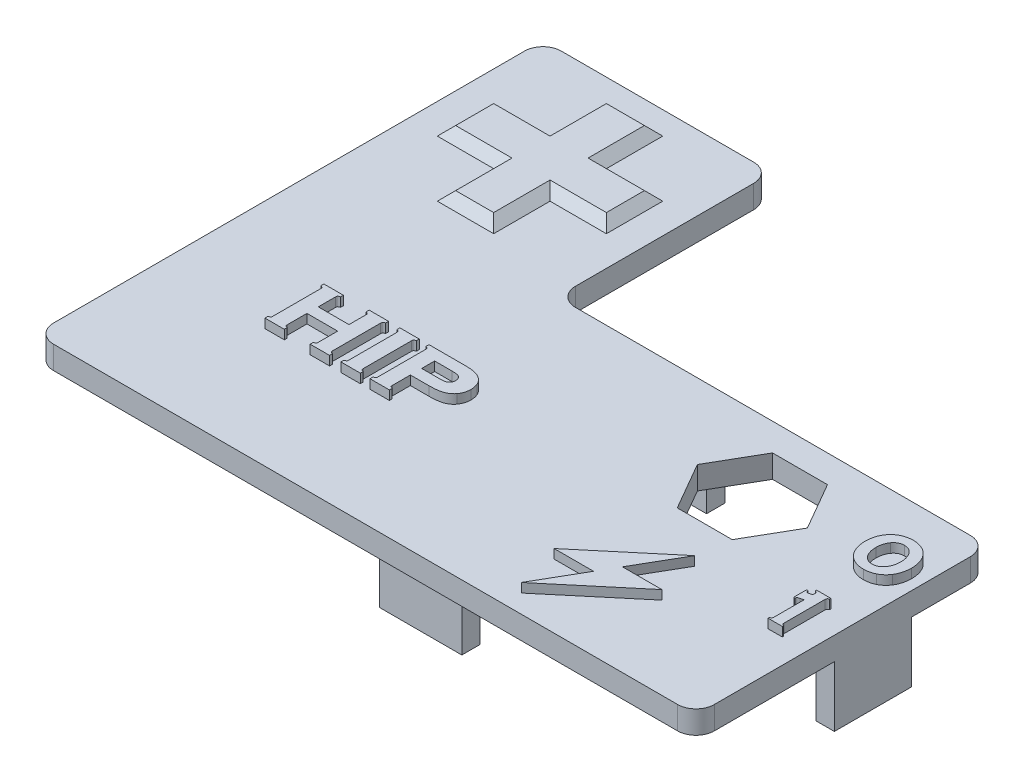
from build123d import *

# Parameters (mm, degrees)
BOSS_EXTRUDE1_DEPTH = 2.5
FILLET1_R           = 2
SKETCH2_W           = 2
SKETCH2_H           = 8.4
SKETCH2_W_2         = 9
SKETCH2_H_2         = 2
BOSS_EXTRUDE2_DEPTH = 6.6
BOSS_EXTRUDE3_DEPTH = 1
CUT_EXTRUDE1_DEPTH  = 2.5
CHAMFER1_SIZE       = 1


with BuildPart() as part:
    # Sketch1 → Boss-Extrude1 (new body)
    with BuildSketch(Plane(origin=(0, 0, 0), x_dir=(1, 0, 0), z_dir=(0, 1, 0))):
        Polygon((-36.05, 15.975), (-36.05, 39.425), (-11.05, 39.425), (-11.05, 15.975), (36.05, 15.975), (36.05, -15.975), (-36.05, -15.975), align=None)
    extrude(amount=BOSS_EXTRUDE1_DEPTH)

    # Fillet1
    fillet1_edges = [part.edges().sort_by_distance(p)[0] for p in [
        (36.05, 1.25, 15.975),
        (-36.05, 1.25, 15.975),
        (-36.05, 1.25, -39.425),
        (-11.05, 1.25, -39.425),
        (-11.05, 1.25, -15.975),
        (36.05, 1.25, -15.975),
    ]]
    fillet(fillet1_edges, radius=FILLET1_R)

    # Sketch2 → Boss-Extrude2 (add)
    with BuildSketch(Plane.XZ):
        with Locations((35.05, -3.325)):
            Rectangle(SKETCH2_W, SKETCH2_H)
        with Locations((4, -13.725)):
            Rectangle(SKETCH2_W_2, SKETCH2_H_2)
        with Locations((4, 12.975)):
            Rectangle(SKETCH2_W_2, SKETCH2_H_2)
    extrude(amount=BOSS_EXTRUDE2_DEPTH)

    # Sketch3 → Boss-Extrude3 (add)
    # profile 1 of 7: a face of its own
    with BuildSketch(Plane(origin=(0, 2.5, 0), x_dir=(1, 0, 0), z_dir=(0, 1, 0))):
        Polygon((21.914101615, -1.975), (19.027350269, -6.975), (23.328173533, -6.975), (14.985898385, -13.975), (17.872649731, -8.975), (13.571826467, -8.975), align=None)
    # profile 2 of 7: a face of its own
    with BuildSketch(Plane(origin=(0, 2.5, 0), x_dir=(1, 0, 0), z_dir=(0, 1, 0))):
        Polygon((-26.625, 36.925), (-20.475, 36.925), (-20.475, 30.775), (-14.325, 30.775), (-14.325, 24.625), (-20.475, 24.625), (-20.475, 18.475), (-26.625, 18.475), (-26.625, 24.625), (-32.775, 24.625), (-32.775, 30.775), (-26.625, 30.775), align=None)
    # profile 3 of 7: a face of its own
    with BuildSketch(Plane(origin=(0, 2.5, 0), x_dir=(1, 0, 0), z_dir=(0, 1, 0))):
        with BuildLine():
            Line((-18.783680556, -0.240972222), (-22.135069444, -0.240972222))
            Line((-22.135069444, -0.240972222), (-22.135069444, -2.383821615))
            add(Edge.make_bspline(
                [(-22.135069444, -2.383821615), (-22.134560924, -2.404062044), (-22.133632782, -2.441004541), (-22.126724134, -2.491370285), (-22.116913761, -2.531950328), (-22.099135807, -2.565289708), (-22.065927707, -2.591094351), (-22.017431016, -2.614286603), (-21.950045692, -2.63858303), (-21.899033709, -2.654599914), (-21.870486111, -2.663563368)],
                knots=[0, 0, 0, 0, 1.112689861, 2.030863194, 2.79083513, 3.401849183, 4.06495506, 5.059212787, 6.354261028, 8, 8, 8, 8], degree=3))
            Line((-21.870486111, -2.663563368), (-21.870486111, -2.975))
            Line((-21.870486111, -2.975), (-23.987152778, -2.975))
            Line((-23.987152778, -2.975), (-23.987152778, -2.645648872))
            add(Edge.make_bspline(
                [(-23.987152778, -2.645648872), (-23.959096859, -2.636151769), (-23.908590644, -2.619055102), (-23.841611165, -2.594288211), (-23.793801903, -2.568428587), (-23.750828013, -2.534493362), (-23.7260889, -2.468688109), (-23.723848947, -2.41467495), (-23.722569444, -2.383821615)],
                knots=[0, 0, 0, 0, 1.287370472, 2.317522002, 3.094744379, 3.646673391, 4.655735433, 6, 6, 6, 6], degree=3))
            Line((-23.722569444, -2.383821615), (-23.722569444, 2.872016059))
            add(Edge.make_bspline(
                [(-23.722569444, 2.872016059), (-23.723733083, 2.90291911), (-23.725754515, 2.956602786), (-23.751219243, 3.02155467), (-23.793784799, 3.055250295), (-23.84161821, 3.081102433), (-23.908588108, 3.105872295), (-23.959095953, 3.122968456), (-23.987152778, 3.132465278)],
                knots=[0, 0, 0, 0, 1.348336138, 2.342281394, 2.895882114, 3.675458579, 4.708730281, 6, 6, 6, 6], degree=3))
            Line((-23.987152778, 3.132465278), (-23.987152778, 3.463194444))
            Line((-23.987152778, 3.463194444), (-21.870486111, 3.463194444))
            Line((-21.870486111, 3.463194444), (-21.870486111, 3.149001736))
            add(Edge.make_bspline(
                [(-21.870486111, 3.149001736), (-21.899576345, 3.140736863), (-21.951329502, 3.12603319), (-22.018368384, 3.100588695), (-22.067489274, 3.079363184), (-22.100250623, 3.053980126), (-22.116641214, 3.021221078), (-22.12702454, 2.98196032), (-22.133489042, 2.932384698), (-22.134513812, 2.895920899), (-22.135069444, 2.876150174)],
                knots=[0, 0, 0, 0, 1.678835892, 2.986743234, 3.979464292, 4.649154438, 5.231503203, 5.974457713, 6.90174799, 8, 8, 8, 8], degree=3))
            Line((-22.135069444, 2.876150174), (-22.135069444, 0.99375))
            Line((-22.135069444, 0.99375), (-18.783680556, 0.99375))
            Line((-18.783680556, 0.99375), (-18.783680556, 2.876150174))
            add(Edge.make_bspline(
                [(-18.783680556, 2.876150174), (-18.784635458, 2.906725209), (-18.786330305, 2.960992525), (-18.8148026, 3.024988409), (-18.857552607, 3.059427337), (-18.904962855, 3.085011392), (-18.970713212, 3.108918029), (-19.020601198, 3.123179378), (-19.048263889, 3.13108724)],
                knots=[0, 0, 0, 0, 1.339108124, 2.3767692, 2.934819577, 3.720662016, 4.736116083, 6, 6, 6, 6], degree=3))
            Line((-19.048263889, 3.13108724), (-19.048263889, 3.463194444))
            Line((-19.048263889, 3.463194444), (-16.931597222, 3.463194444))
            Line((-16.931597222, 3.463194444), (-16.931597222, 3.151757813))
            add(Edge.make_bspline(
                [(-16.931597222, 3.151757813), (-16.96061746, 3.142373337), (-17.01260413, 3.125562048), (-17.080746578, 3.099834777), (-17.129679953, 3.076489432), (-17.162782162, 3.051272443), (-17.179053242, 3.018441172), (-17.189880598, 2.979312497), (-17.194074053, 2.929039758), (-17.195434196, 2.892220265), (-17.196180556, 2.872016059)],
                knots=[0, 0, 0, 0, 1.677063113, 3.004280154, 3.998210204, 4.661097541, 5.237530725, 5.972938197, 6.887676847, 8, 8, 8, 8], degree=3))
            Line((-17.196180556, 2.872016059), (-17.196180556, -2.383821615))
            add(Edge.make_bspline(
                [(-17.196180556, -2.383821615), (-17.195466383, -2.404487304), (-17.194177923, -2.441770881), (-17.189676161, -2.492921509), (-17.179245547, -2.532520488), (-17.163133146, -2.565849021), (-17.129338032, -2.589006053), (-17.082054183, -2.613649766), (-17.013482048, -2.638792842), (-16.961049667, -2.655536255), (-16.931597222, -2.664941406)],
                knots=[0, 0, 0, 0, 1.132588045, 2.043335292, 2.79974177, 3.373659724, 4.017655279, 4.984956659, 6.306382474, 8, 8, 8, 8], degree=3))
            Line((-16.931597222, -2.664941406), (-16.931597222, -2.975))
            Line((-16.931597222, -2.975), (-19.048263889, -2.975))
            Line((-19.048263889, -2.975), (-19.048263889, -2.644270833))
            add(Edge.make_bspline(
                [(-19.048263889, -2.644270833), (-19.020513353, -2.636054777), (-18.970409832, -2.62122071), (-18.90582761, -2.594668492), (-18.856663596, -2.571594882), (-18.8151216, -2.534759181), (-18.786242395, -2.470161631), (-18.784603157, -2.414915461), (-18.783680556, -2.383821615)],
                knots=[0, 0, 0, 0, 1.258257265, 2.271780215, 3.040906906, 3.607086496, 4.653211897, 6, 6, 6, 6], degree=3))
            Line((-18.783680556, -2.383821615), (-18.783680556, -0.240972222))
        make_face()
    # profile 4 of 7: a face of its own
    with BuildSketch(Plane(origin=(0, 2.5, 0), x_dir=(1, 0, 0), z_dir=(0, 1, 0))):
        with BuildLine():
            Line((-15.432291667, -2.378309462), (-15.432291667, 2.872016059))
            add(Edge.make_bspline(
                [(-15.432291667, 2.872016059), (-15.433455305, 2.90291911), (-15.435476737, 2.956602786), (-15.460941465, 3.02155467), (-15.503507021, 3.055250295), (-15.551340432, 3.081102433), (-15.61831033, 3.105872295), (-15.668818175, 3.122968456), (-15.696875, 3.132465278)],
                knots=[0, 0, 0, 0, 1.348336138, 2.342281394, 2.895882114, 3.675458579, 4.708730281, 6, 6, 6, 6], degree=3))
            Line((-15.696875, 3.132465278), (-15.696875, 3.463194444))
            Line((-15.696875, 3.463194444), (-13.580208333, 3.463194444))
            Line((-13.580208333, 3.463194444), (-13.580208333, 3.149001736))
            add(Edge.make_bspline(
                [(-13.580208333, 3.149001736), (-13.609338439, 3.140862152), (-13.661321728, 3.126336892), (-13.72828787, 3.099443094), (-13.776932675, 3.076521788), (-13.809993843, 3.051264167), (-13.826356622, 3.01845182), (-13.836748821, 2.979209149), (-13.843272569, 2.929170621), (-13.844253968, 2.892246448), (-13.844791667, 2.872016059)],
                knots=[0, 0, 0, 0, 1.6692232, 2.978764111, 3.977144801, 4.643000429, 5.222014777, 5.960715272, 6.882696063, 8, 8, 8, 8], degree=3))
            Line((-13.844791667, 2.872016059), (-13.844791667, -2.378309462))
            add(Edge.make_bspline(
                [(-13.844791667, -2.378309462), (-13.844308587, -2.399472319), (-13.84343378, -2.437795987), (-13.836351847, -2.489945623), (-13.826911135, -2.531568086), (-13.808841961, -2.565285209), (-13.775656853, -2.59109629), (-13.727150385, -2.614285804), (-13.659768956, -2.638583322), (-13.608756304, -2.654600019), (-13.580208333, -2.663563368)],
                knots=[0, 0, 0, 0, 1.148820936, 2.080391588, 2.85507263, 3.458551883, 4.113480583, 5.09547749, 6.374555674, 8, 8, 8, 8], degree=3))
            Line((-13.580208333, -2.663563368), (-13.580208333, -2.975))
            Line((-13.580208333, -2.975), (-15.696875, -2.975))
            Line((-15.696875, -2.975), (-15.696875, -2.645648872))
            add(Edge.make_bspline(
                [(-15.696875, -2.645648872), (-15.668819954, -2.636151539), (-15.61831531, -2.619054457), (-15.551326597, -2.594290002), (-15.503540614, -2.568424236), (-15.460158716, -2.534244531), (-15.435662628, -2.466247275), (-15.433525659, -2.41050045), (-15.432291667, -2.378309462)],
                knots=[0, 0, 0, 0, 1.270903566, 2.287878308, 3.055159144, 3.600028367, 4.614137041, 6, 6, 6, 6], degree=3))
        make_face()
    # profile 5 of 7: a face of its own
    with BuildSketch(Plane(origin=(0, 2.5, 0), x_dir=(1, 0, 0), z_dir=(0, 1, 0))):
        with BuildLine():
            Line((-10.669791667, -0.417361111), (-10.669791667, -2.382443576))
            add(Edge.make_bspline(
                [(-10.669791667, -2.382443576), (-10.669284182, -2.402685004), (-10.668357931, -2.439629324), (-10.661437655, -2.489983859), (-10.651660395, -2.530595824), (-10.633470579, -2.564421983), (-10.600157401, -2.590505187), (-10.551638382, -2.614440749), (-10.485293801, -2.640566132), (-10.433850218, -2.655338603), (-10.405208333, -2.663563368)],
                knots=[0, 0, 0, 0, 1.110645692, 2.027132209, 2.78570797, 3.395599503, 4.093037155, 5.063112639, 6.364849726, 8, 8, 8, 8], degree=3))
            Line((-10.405208333, -2.663563368), (-10.405208333, -2.975))
            Line((-10.405208333, -2.975), (-12.521875, -2.975))
            Line((-12.521875, -2.975), (-12.521875, -2.645648872))
            add(Edge.make_bspline(
                [(-12.521875, -2.645648872), (-12.493819081, -2.636151769), (-12.443312866, -2.619055102), (-12.376333388, -2.594288211), (-12.328524126, -2.568428587), (-12.285550235, -2.534493362), (-12.260811122, -2.468688109), (-12.25857117, -2.41467495), (-12.257291667, -2.383821615)],
                knots=[0, 0, 0, 0, 1.287370472, 2.317522002, 3.094744379, 3.646673391, 4.655735433, 6, 6, 6, 6], degree=3))
            Line((-12.257291667, -2.383821615), (-12.257291667, 2.866503906))
            add(Edge.make_bspline(
                [(-12.257291667, 2.866503906), (-12.258407314, 2.898744591), (-12.260324886, 2.954159803), (-12.28554784, 3.021309284), (-12.328524822, 3.055245134), (-12.376333101, 3.081104559), (-12.443312969, 3.105871529), (-12.493819118, 3.122968183), (-12.521875, 3.132465278)],
                knots=[0, 0, 0, 0, 1.390022291, 2.38916702, 2.935671537, 3.705255179, 4.725282125, 6, 6, 6, 6], degree=3))
            Line((-12.521875, 3.132465278), (-12.521875, 3.463194444))
            Line((-12.521875, 3.463194444), (-8.595844184, 3.463194444))
            add(Edge.make_bspline(
                [(-8.595844184, 3.463194444), (-8.485121626, 3.461726743), (-8.274545568, 3.458935415), (-7.975002823, 3.442150988), (-7.708487486, 3.411022255), (-7.471581147, 3.367144064), (-7.259232237, 3.309229722), (-7.065741121, 3.235746443), (-6.888624901, 3.147362239), (-6.782069886, 3.074417644), (-6.729980469, 3.038758681)],
                knots=[0, 0, 0, 0, 1.365616316, 2.597177169, 3.69830487, 4.67274238, 5.566127339, 6.408897041, 7.222189352, 8, 8, 8, 8], degree=3))
            add(Edge.make_bspline(
                [(-6.729980469, 3.038758681), (-6.670923478, 2.991857058), (-6.555583712, 2.900257028), (-6.40572654, 2.743084315), (-6.281082063, 2.574512555), (-6.218118022, 2.452630497), (-6.18703342, 2.392458767)],
                knots=[0, 0, 0, 0, 1.060579671, 2.07133836, 3.04784258, 4, 4, 4, 4], degree=3))
            add(Edge.make_bspline(
                [(-6.18703342, 2.392458767), (-6.15734027, 2.321385826), (-6.098790717, 2.181242762), (-6.040948026, 1.963463573), (-6.002786774, 1.745207481), (-5.997920257, 1.598868793), (-5.995486111, 1.525672743)],
                knots=[0, 0, 0, 0, 1.032885136, 2.036663799, 3.017973605, 4, 4, 4, 4], degree=3))
            add(Edge.make_bspline(
                [(-5.995486111, 1.525672743), (-5.996412936, 1.473252634), (-5.998255875, 1.369018191), (-6.017087347, 1.214738061), (-6.045833775, 1.064103175), (-6.085833471, 0.916925003), (-6.13843792, 0.77378374), (-6.202115518, 0.634287972), (-6.276525421, 0.497912283), (-6.335122673, 0.411756079), (-6.364800347, 0.36812066)],
                knots=[0, 0, 0, 0, 1.018315734, 2.024863642, 3.015812015, 3.996859345, 4.985311521, 5.976058821, 6.974937151, 8, 8, 8, 8], degree=3))
            add(Edge.make_bspline(
                [(-6.364800347, 0.36812066), (-6.415945629, 0.302736778), (-6.518603122, 0.171499933), (-6.713932306, 0.00865705), (-6.93574427, -0.129049985), (-7.143926934, -0.217236397), (-7.325471914, -0.274947131), (-7.475374563, -0.313647561), (-7.637190796, -0.344169459), (-7.810195987, -0.372739768), (-7.995599812, -0.392880623), (-8.192875586, -0.405586623), (-8.401424969, -0.416419274), (-8.544381544, -0.417041268), (-8.617892795, -0.417361111)],
                knots=[0, 0, 0, 0, 1.201310303, 2.411239124, 3.665018975, 4.978370806, 5.678024487, 6.427946528, 7.222517649, 8.066070971, 8.971202528, 9.926434538, 10.93372941, 12, 12, 12, 12], degree=3))
            Line((-8.617892795, -0.417361111), (-10.669791667, -0.417361111))
        make_face()
        with BuildLine():
            Line((-10.669791667, 0.817361111), (-8.795659722, 0.817361111))
            add(Edge.make_bspline(
                [(-8.795659722, 0.817361111), (-8.74834269, 0.817511877), (-8.657347126, 0.817801814), (-8.526327603, 0.823151736), (-8.406427858, 0.833096715), (-8.297798046, 0.844761355), (-8.200582231, 0.861000125), (-8.115234341, 0.882094792), (-8.040187903, 0.903908779), (-7.996193179, 0.92478351), (-7.975726997, 0.934494358)],
                knots=[0, 0, 0, 0, 1.360814978, 2.616988466, 3.770074927, 4.820508599, 5.758780969, 6.601504719, 7.349425165, 8, 8, 8, 8], degree=3))
            add(Edge.make_bspline(
                [(-7.975726997, 0.934494358), (-7.954119494, 0.947606213), (-7.910227329, 0.974240839), (-7.852148842, 1.027625005), (-7.80087208, 1.092179621), (-7.755781794, 1.166795319), (-7.717401768, 1.248674827), (-7.691534277, 1.337536043), (-7.674132998, 1.429904473), (-7.672174379, 1.493436107), (-7.671180556, 1.525672743)],
                knots=[0, 0, 0, 0, 0.870026804, 1.767319523, 2.702549363, 3.705127487, 4.768448416, 5.810912046, 6.889233173, 8, 8, 8, 8], degree=3))
            add(Edge.make_bspline(
                [(-7.671180556, 1.525672743), (-7.672147591, 1.557001478), (-7.674052997, 1.618730305), (-7.691999337, 1.709105502), (-7.71697172, 1.796901395), (-7.756598964, 1.878136868), (-7.800374756, 1.953504867), (-7.852258932, 2.018094435), (-7.909847667, 2.071714331), (-7.954067403, 2.097386341), (-7.975726997, 2.109960938)],
                knots=[0, 0, 0, 0, 1.088960889, 2.1456429, 3.197598088, 4.256092488, 5.281473888, 6.22521893, 7.130681436, 8, 8, 8, 8], degree=3))
            add(Edge.make_bspline(
                [(-7.975726997, 2.109960938), (-7.996237508, 2.119525127), (-8.040455922, 2.140144471), (-8.114715856, 2.16469867), (-8.201019092, 2.182366684), (-8.297118113, 2.201712914), (-8.405544955, 2.212603113), (-8.524937259, 2.222734151), (-8.656431752, 2.228034086), (-8.747884483, 2.228321879), (-8.795659722, 2.228472222)],
                knots=[0, 0, 0, 0, 0.650292609, 1.401959552, 2.241310584, 3.181497259, 4.218355746, 5.370941986, 6.626570533, 8, 8, 8, 8], degree=3))
            Line((-8.795659722, 2.228472222), (-10.669791667, 2.228472222))
            Line((-10.669791667, 2.228472222), (-10.669791667, 0.817361111))
        make_face(mode=Mode.SUBTRACT)
    # profile 6 of 7: a face of its own
    with BuildSketch(Plane(origin=(0, 2.5, 0), x_dir=(1, 0, 0), z_dir=(0, 1, 0))):
        with BuildLine():
            add(Edge.make_bspline(
                [(32.382014428, 11.401339458), (32.468432483, 11.399550556), (32.638058585, 11.396039202), (32.886789345, 11.362443841), (33.124301132, 11.310355584), (33.35043399, 11.235942), (33.565902937, 11.141450505), (33.769709277, 11.024743574), (33.963127601, 10.887284817), (34.080072389, 10.780071568), (34.139221267, 10.725844753)],
                knots=[0, 0, 0, 0, 1.073153218, 2.106444017, 3.112369148, 4.090464945, 5.059216053, 6.030425776, 7.00381961, 8, 8, 8, 8], degree=3))
            add(Edge.make_bspline(
                [(34.139221267, 10.725844753), (34.202189969, 10.660865737), (34.327635573, 10.531415204), (34.487336217, 10.312544747), (34.624697191, 10.077829477), (34.734991918, 9.823716392), (34.821423071, 9.552684472), (34.88177634, 9.263860294), (34.919333164, 8.957737908), (34.923963786, 8.747421133), (34.926339458, 8.639521243)],
                knots=[0, 0, 0, 0, 0.946003957, 1.884619416, 2.827244166, 3.787183327, 4.777475434, 5.799482827, 6.871057433, 8, 8, 8, 8], degree=3))
            add(Edge.make_bspline(
                [(34.926339458, 8.639521243), (34.925228432, 8.569636233), (34.923000298, 8.429483694), (34.897877859, 8.218600817), (34.862013964, 8.006234386), (34.810074355, 7.79497588), (34.746618507, 7.590013207), (34.672330085, 7.396132677), (34.585993967, 7.216360854), (34.518701324, 7.105070174), (34.485599301, 7.050325012)],
                knots=[0, 0, 0, 0, 1.004071955, 2.013639758, 3.04885576, 4.098667877, 5.138089738, 6.131338962, 7.080784209, 8, 8, 8, 8], degree=3))
            add(Edge.make_bspline(
                [(34.485599301, 7.050325012), (34.455110777, 7.005029135), (34.394574291, 6.915091911), (34.294219135, 6.788547508), (34.186738719, 6.670716729), (34.072121885, 6.560834267), (33.950618217, 6.45847821), (33.821361857, 6.365064583), (33.684853824, 6.280716063), (33.589851061, 6.230814774), (33.541978078, 6.205668942)],
                knots=[0, 0, 0, 0, 1.021813405, 2.028861523, 3.020014673, 4.005245766, 4.999100318, 5.991605089, 6.987946743, 8, 8, 8, 8], degree=3))
            add(Edge.make_bspline(
                [(33.541978078, 6.205668942), (33.498508798, 6.185122666), (33.411226886, 6.143867826), (33.275224939, 6.092728112), (33.135805227, 6.048773349), (32.992830583, 6.013162609), (32.846447584, 5.985386928), (32.696158884, 5.966397409), (32.542223858, 5.952655298), (32.438049358, 5.951788856), (32.3854667, 5.951351514)],
                knots=[0, 0, 0, 0, 0.965635251, 1.938897805, 2.916301143, 3.901331103, 4.897393455, 5.907782413, 6.943941558, 8, 8, 8, 8], degree=3))
            add(Edge.make_bspline(
                [(32.3854667, 5.951351514), (32.299047047, 5.95313917), (32.129417811, 5.956648079), (31.881081329, 5.990210874), (31.643727465, 6.042136188), (31.418495849, 6.118328503), (31.202579797, 6.211797833), (30.999902847, 6.330741113), (30.807036533, 6.468518725), (30.690477792, 6.576072757), (30.631712134, 6.630298492)],
                knots=[0, 0, 0, 0, 1.073918353, 2.107945867, 3.109934218, 4.090225059, 5.059666867, 6.029812273, 7.006686444, 8, 8, 8, 8], degree=3))
            add(Edge.make_bspline(
                [(30.631712134, 6.630298492), (30.578051944, 6.68570811), (30.47167071, 6.795557582), (30.332359077, 6.976778167), (30.210372245, 7.167597339), (30.144448932, 7.302802231), (30.111569704, 7.370235622)],
                knots=[0, 0, 0, 0, 1.017136034, 2.016470446, 3.010715361, 4, 4, 4, 4], degree=3))
            add(Edge.make_bspline(
                [(30.111569704, 7.370235622), (30.090306566, 7.421423644), (30.047865526, 7.523594495), (29.994117787, 7.680477991), (29.94784537, 7.839797506), (29.909509992, 8.002158818), (29.881326613, 8.167519343), (29.860417747, 8.335300811), (29.847443608, 8.505829933), (29.845549408, 8.620703137), (29.844593943, 8.678647001)],
                knots=[0, 0, 0, 0, 0.989037334, 1.974110003, 2.957730517, 3.949087038, 4.949643134, 5.949918149, 6.965906225, 8, 8, 8, 8], degree=3))
            add(Edge.make_bspline(
                [(29.844593943, 8.678647001), (29.845876647, 8.755795243), (29.848402147, 8.9076915), (29.869651753, 9.131431539), (29.903920768, 9.347140487), (29.95208879, 9.554914297), (30.014946317, 9.754566758), (30.088872089, 9.947234794), (30.179139451, 10.131422951), (30.24990887, 10.247642109), (30.2853341, 10.305818233)],
                knots=[0, 0, 0, 0, 1.083169043, 2.132638677, 3.152794258, 4.148408572, 5.124614427, 6.089895914, 7.04385428, 8, 8, 8, 8], degree=3))
            add(Edge.make_bspline(
                [(30.2853341, 10.305818233), (30.315028544, 10.350369364), (30.373974029, 10.438806379), (30.472921305, 10.563345686), (30.57803144, 10.681617079), (30.694213568, 10.788763921), (30.815378775, 10.891425435), (30.945152115, 10.985635492), (31.083805815, 11.070788964), (31.18032353, 11.12148043), (31.228955323, 11.147022031)],
                knots=[0, 0, 0, 0, 1.003437828, 1.991892124, 2.979796805, 3.966863392, 4.952172907, 5.956306395, 6.970256545, 8, 8, 8, 8], degree=3))
            add(Edge.make_bspline(
                [(31.228955323, 11.147022031), (31.270932606, 11.166694387), (31.355361765, 11.206261513), (31.487071434, 11.257065645), (31.624157788, 11.29920433), (31.765901293, 11.334869868), (31.912528424, 11.364004451), (32.064337542, 11.384423527), (32.221469771, 11.397129869), (32.327905808, 11.399920694), (32.382014428, 11.401339458)],
                knots=[0, 0, 0, 0, 0.934240099, 1.879042671, 2.842578357, 3.82333238, 4.824118634, 5.854165028, 6.909127293, 8, 8, 8, 8], degree=3))
        make_face()
        with BuildLine():
            add(Edge.make_bspline(
                [(32.382014428, 10.443909144), (32.330107704, 10.442579416), (32.228709456, 10.439981831), (32.080912124, 10.413208182), (31.940892632, 10.372710342), (31.80923765, 10.3127292), (31.685736168, 10.236745392), (31.571200854, 10.143298856), (31.463830486, 10.034634312), (31.402119697, 9.95143763), (31.370498507, 9.908806864)],
                knots=[0, 0, 0, 0, 1.042819193, 2.037116442, 3.010974118, 3.967351153, 4.9371674, 5.919058032, 6.933705689, 8, 8, 8, 8], degree=3))
            add(Edge.make_bspline(
                [(31.370498507, 9.908806864), (31.342384626, 9.866751394), (31.285928663, 9.782299088), (31.216826161, 9.645396273), (31.155860398, 9.502386058), (31.108754254, 9.350879597), (31.068350228, 9.19335416), (31.042993903, 9.027596693), (31.026291448, 8.854674057), (31.024092271, 8.736610354), (31.022969715, 8.676345486)],
                knots=[0, 0, 0, 0, 0.93255636, 1.872682318, 2.824326125, 3.797954353, 4.796974801, 5.822053604, 6.88828109, 8, 8, 8, 8], degree=3))
            add(Edge.make_bspline(
                [(31.022969715, 8.676345486), (31.024092271, 8.616080618), (31.026291448, 8.498016915), (31.042993903, 8.325094279), (31.068350228, 8.159336813), (31.108754254, 8.001811375), (31.155860398, 7.850304914), (31.216826161, 7.7072947), (31.285928663, 7.570391885), (31.342384626, 7.485939578), (31.370498507, 7.443884108)],
                knots=[0, 0, 0, 0, 1.11171891, 2.177946396, 3.203025199, 4.202045647, 5.175673875, 6.127317682, 7.06744364, 8, 8, 8, 8], degree=3))
            add(Edge.make_bspline(
                [(31.370498507, 7.443884108), (31.402134497, 7.401271831), (31.46387417, 7.318111229), (31.571248503, 7.208975074), (31.686800931, 7.116315561), (31.81034298, 7.039899197), (31.942059933, 6.980023099), (32.082769933, 6.939161636), (32.231433011, 6.912899234), (32.333569458, 6.91016907), (32.3854667, 6.908781829)],
                knots=[0, 0, 0, 0, 1.063473786, 2.075437533, 3.060726969, 4.027977892, 4.981825152, 5.953106813, 6.959939236, 8, 8, 8, 8], degree=3))
            add(Edge.make_bspline(
                [(32.3854667, 6.908781829), (32.437747414, 6.910153641), (32.540267403, 6.912843699), (32.689332318, 6.939117631), (32.830296485, 6.980279256), (32.962610584, 7.039627178), (33.086342505, 7.115977547), (33.200840248, 7.209417891), (33.308276244, 7.317744704), (33.369255985, 7.401208906), (33.400434894, 7.443884108)],
                knots=[0, 0, 0, 0, 1.047221834, 2.053552159, 3.024349451, 3.984735419, 4.951503982, 5.930308986, 6.941768075, 8, 8, 8, 8], degree=3))
            add(Edge.make_bspline(
                [(33.400434894, 7.443884108), (33.428508557, 7.485959793), (33.484694663, 7.570169287), (33.553983286, 7.705799621), (33.614691001, 7.847056109), (33.663849712, 7.995276131), (33.702124193, 8.150317052), (33.727994165, 8.312010867), (33.744585426, 8.480371734), (33.74682408, 8.594985312), (33.747963686, 8.653330334)],
                knots=[0, 0, 0, 0, 0.948852136, 1.899014993, 2.854022735, 3.833213073, 4.826990556, 5.848658492, 6.904841214, 8, 8, 8, 8], degree=3))
            add(Edge.make_bspline(
                [(33.747963686, 8.653330334), (33.746825086, 8.715891854), (33.744592917, 8.838540571), (33.728119594, 9.01802154), (33.702311975, 9.188918729), (33.664198674, 9.350929634), (33.614801208, 9.504076754), (33.55471392, 9.648338569), (33.48520864, 9.784406024), (33.428558598, 9.867536866), (33.400434894, 9.908806864)],
                knots=[0, 0, 0, 0, 1.133942127, 2.223036554, 3.264496894, 4.264655341, 5.236594568, 6.177982103, 7.095465985, 8, 8, 8, 8], degree=3))
            add(Edge.make_bspline(
                [(33.400434894, 9.908806864), (33.36910893, 9.95058745), (33.307494104, 10.032765399), (33.201192962, 10.141458772), (33.08520897, 10.232937717), (32.961214019, 10.308428861), (32.82866026, 10.367831385), (32.687453139, 10.410064396), (32.537624672, 10.437365403), (32.434685141, 10.441694228), (32.382014428, 10.443909144)],
                knots=[0, 0, 0, 0, 1.045500132, 2.056387103, 3.035845357, 3.998054476, 4.957897214, 5.937717248, 6.944798926, 8, 8, 8, 8], degree=3))
        make_face(mode=Mode.SUBTRACT)
    # profile 7 of 7: a face of its own
    with BuildSketch(Plane(origin=(0, 2.5, 0), x_dir=(1, 0, 0), z_dir=(0, 1, 0))):
        with BuildLine():
            Line((31.243915172, -0.498636429), (31.243915172, 0.900684799))
            Line((31.243915172, 0.900684799), (31.391212143, 0.900684799))
            add(Edge.make_bspline(
                [(31.391212143, 0.900684799), (31.398268517, 0.87950415), (31.411089799, 0.841019361), (31.431706847, 0.789658325), (31.451629677, 0.750074374), (31.479198622, 0.713138551), (31.529001157, 0.683298699), (31.573680158, 0.681005482), (31.598348509, 0.679739342)],
                knots=[0, 0, 0, 0, 1.209468618, 2.197578737, 2.997195675, 3.604247324, 4.677247354, 6, 6, 6, 6], degree=3))
            add(Edge.make_bspline(
                [(31.598348509, 0.679739342), (31.614503879, 0.680530984), (31.652484877, 0.682392119), (31.689723644, 0.69020789), (31.711122753, 0.694699191)],
                knots=[0, 0, 0, 0, 0.850707975, 2, 2, 2, 2], degree=3))
            Line((31.711122753, 0.694699191), (32.054048515, 0.777553737))
            Line((32.054048515, 0.777553737), (32.054048515, 0.998499194))
            add(Edge.make_bspline(
                [(32.054048515, 0.998499194), (32.053153395, 1.016136322), (32.051450623, 1.04968716), (32.04509497, 1.097426662), (32.027591166, 1.13720423), (32.006876177, 1.172569699), (31.976496441, 1.202063507), (31.937219827, 1.22747758), (31.888658984, 1.250160031), (31.852424309, 1.262400369), (31.833103057, 1.268927228)],
                knots=[0, 0, 0, 0, 1.106558312, 2.104988926, 2.987628068, 3.806956074, 4.655647557, 5.607696333, 6.724362777, 8, 8, 8, 8], degree=3))
            Line((31.833103057, 1.268927228), (31.833103057, 1.416224199))
            Line((31.833103057, 1.416224199), (33.379721258, 1.416224199))
            Line((33.379721258, 1.416224199), (33.379721258, 1.268927228))
            add(Edge.make_bspline(
                [(33.379721258, 1.268927228), (33.360348558, 1.262495281), (33.324345796, 1.250541973), (33.27640553, 1.226782484), (33.236396643, 1.202487164), (33.206139916, 1.172466943), (33.184307301, 1.136941417), (33.169902972, 1.094922186), (33.160614792, 1.045694751), (33.159416358, 1.010438801), (33.158775801, 0.991594649)],
                knots=[0, 0, 0, 0, 1.254568991, 2.331525691, 3.287583442, 4.122258064, 4.928054172, 5.831664144, 6.841033924, 8, 8, 8, 8], degree=3))
            Line((33.158775801, 0.991594649), (33.158775801, -3.458384949))
            add(Edge.make_bspline(
                [(33.158775801, -3.458384949), (33.159406696, -3.477230099), (33.160587053, -3.512487915), (33.170061464, -3.562059451), (33.18437416, -3.604755751), (33.20572048, -3.641480848), (33.236764237, -3.671443576), (33.275984911, -3.697266448), (33.324417624, -3.720680049), (33.360373686, -3.732701297), (33.379721258, -3.739169801)],
                knots=[0, 0, 0, 0, 1.150992626, 2.15341815, 3.072897939, 3.893163974, 4.722096206, 5.684514728, 6.754062187, 8, 8, 8, 8], degree=3))
            Line((33.379721258, -3.739169801), (33.379721258, -3.886466773))
            Line((33.379721258, -3.886466773), (31.833103057, -3.886466773))
            Line((31.833103057, -3.886466773), (31.833103057, -3.739169801))
            add(Edge.make_bspline(
                [(31.833103057, -3.739169801), (31.852422792, -3.732641981), (31.888654622, -3.720399842), (31.937233864, -3.697729044), (31.976454206, -3.672279329), (32.007252623, -3.642669561), (32.027533979, -3.606204094), (32.045100302, -3.56534107), (32.051501157, -3.516088113), (32.053165653, -3.48139139), (32.054048515, -3.46298798)],
                knots=[0, 0, 0, 0, 1.257665914, 2.358600645, 3.297236858, 4.133971888, 4.961959145, 5.854092924, 6.861794288, 8, 8, 8, 8], degree=3))
            Line((32.054048515, -3.46298798), (32.054048515, -0.189082638))
            Line((32.054048515, -0.189082638), (31.67890154, -0.277690972))
            add(Edge.make_bspline(
                [(31.67890154, -0.277690972), (31.658569476, -0.282202783), (31.620352252, -0.290683421), (31.566929889, -0.303897094), (31.524368677, -0.324305913), (31.476357764, -0.352357269), (31.428095679, -0.411042852), (31.404479269, -0.46712874), (31.391212143, -0.498636429)],
                knots=[0, 0, 0, 0, 0.972061978, 1.827139195, 2.555513298, 3.166068865, 4.407966363, 6, 6, 6, 6], degree=3))
            Line((31.391212143, -0.498636429), (31.243915172, -0.498636429))
        make_face()
    extrude(amount=BOSS_EXTRUDE3_DEPTH)

    # Sketch4 → Cut-Extrude1 (cut)
    with BuildSketch(Plane(origin=(0, 2.5, 0), x_dir=(1, 0, 0), z_dir=(0, 1, 0))):
        Polygon((21.45, 2.582695155), (24.45, 7.778847577), (21.45, 12.975), (15.45, 12.975), (12.45, 7.778847577), (15.45, 2.582695155), align=None)
    extrude(amount=-CUT_EXTRUDE1_DEPTH, mode=Mode.SUBTRACT)

    # Chamfer1
    chamfer1_edges = [part.edges().sort_by_distance(p)[0] for p in [
        (-23.55, 3.5, -36.925),
        (-20.475, 3.5, -33.85),
        (-17.4, 3.5, -30.775),
        (-14.325, 3.5, -27.7),
        (-17.4, 3.5, -24.625),
        (-20.475, 3.5, -21.55),
        (-23.55, 3.5, -18.475),
        (-26.625, 3.5, -21.55),
        (-29.7, 3.5, -24.625),
        (-32.775, 3.5, -27.7),
        (-29.7, 3.5, -30.775),
        (-26.625, 3.5, -33.85),
    ]]
    chamfer(chamfer1_edges, length=CHAMFER1_SIZE - 0.0001)  # a hair under: the kernel refuses the full size


solid = part.part
